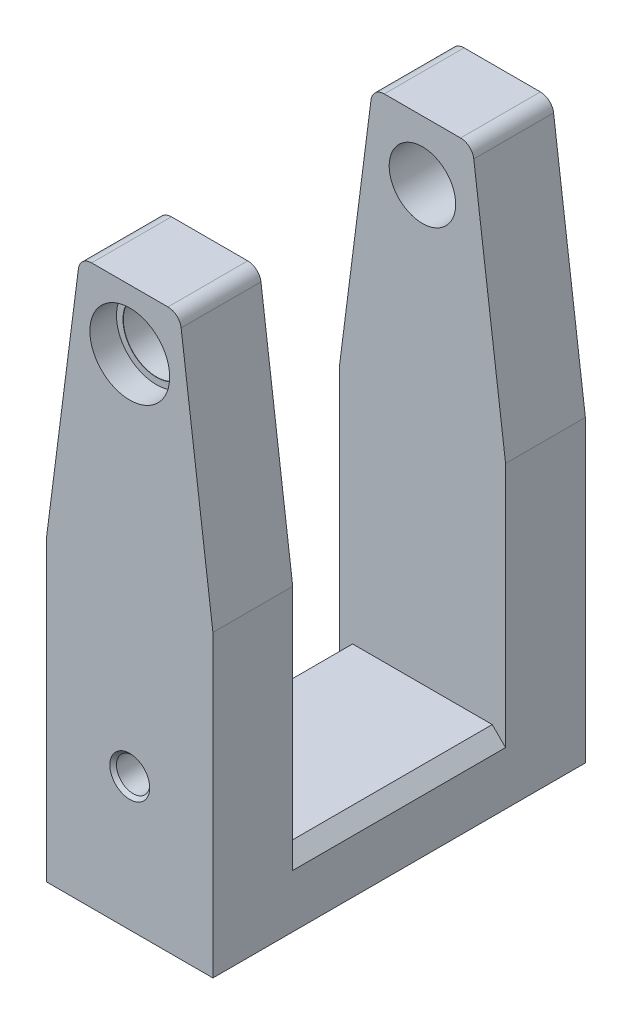
from build123d import *

# Parameters (mm, degrees)
BOSS_EXTRUDE3_DEPTH         = 28
SKETCH4_W                   = 32
SKETCH4_H                   = 74
CUT_EXTRUDE2_DEPTH          = 93.005434622
M6_TAPPED_HOLE1_D           = 5
M6_TAPPED_HOLE1_DEPTH       = 27
M6_TAPPED_HOLE1_CSINK_D     = 6
M6_TAPPED_HOLE1_CSINK_ANGLE = 90
M6_TAPPED_HOLE1_TIP         = 1.502151548
CHAMFER1_SIZE               = 2
FILLET2_R                   = 2


with BuildPart() as part:
    # Sketch3 → Boss-Extrude3 (new, symmetric)
    with BuildSketch(Plane.XY):
        Polygon((12.5, 0), (-12.5, 0), (-12.5, 45), (-7.5, 84), (7.5, 84), (12.5, 45), align=None)
    extrude(amount=BOSS_EXTRUDE3_DEPTH, both=True)

    # Sketch4 → Cut-Extrude2 (cut, through all)
    with BuildSketch(Plane(origin=(12.5, 0, 0), x_dir=(0, 0, -1), z_dir=(1, 0, 0))):
        with Locations((0, 47)):
            Rectangle(SKETCH4_W, SKETCH4_H)
    extrude(amount=-CUT_EXTRUDE2_DEPTH, mode=Mode.SUBTRACT)

    # Sketch7 → CBORE for M4 Hex Socket Head Cap Screw1 (revolve, cut)
    with BuildSketch(Plane(origin=(0, 75, 28), x_dir=(0, -1, 0), z_dir=(1, 0, 0))):
        Polygon((0, 0), (0, 23.004303095), (5, 20), (5, 4.025), (5.025, 4), (6, 4), (6, 0), align=None)
    cbore_for_m4_hex_socket_head_cap_screw1 = revolve(axis=Axis((0, 75, 34.35), (0, 0, -1)), mode=Mode.SUBTRACT)

    # Mirror1: CBORE for M4 Hex Socket Head Cap Screw1 across plane
    add(cbore_for_m4_hex_socket_head_cap_screw1.mirror(Plane.XY), mode=Mode.SUBTRACT)

    # M6 Tapped Hole1
    with Locations(Plane.XY.offset(28)):
        with Locations((0, 20)):
            CounterSinkHole(M6_TAPPED_HOLE1_D / 2, M6_TAPPED_HOLE1_CSINK_D / 2, depth=M6_TAPPED_HOLE1_DEPTH, counter_sink_angle=M6_TAPPED_HOLE1_CSINK_ANGLE)
            with Locations((0, 0, -(M6_TAPPED_HOLE1_DEPTH + M6_TAPPED_HOLE1_TIP / 2))):  # 118° drill point
                Cone(0, M6_TAPPED_HOLE1_D / 2, M6_TAPPED_HOLE1_TIP, mode=Mode.SUBTRACT)

    # Chamfer1
    chamfer1_edges = [part.edges().sort_by_distance(p)[0] for p in [
        (-12.5, 10, 0),
        (12.5, 10, 0),
    ]]
    chamfer(chamfer1_edges, length=CHAMFER1_SIZE)

    # Fillet2
    fillet2_edges = [part.edges().sort_by_distance(p)[0] for p in [
        (7.5, 84, -22),
        (-7.5, 84, 22),
        (7.5, 84, 22),
        (-7.5, 84, -22),
    ]]
    fillet(fillet2_edges, radius=FILLET2_R)


solid = part.part
